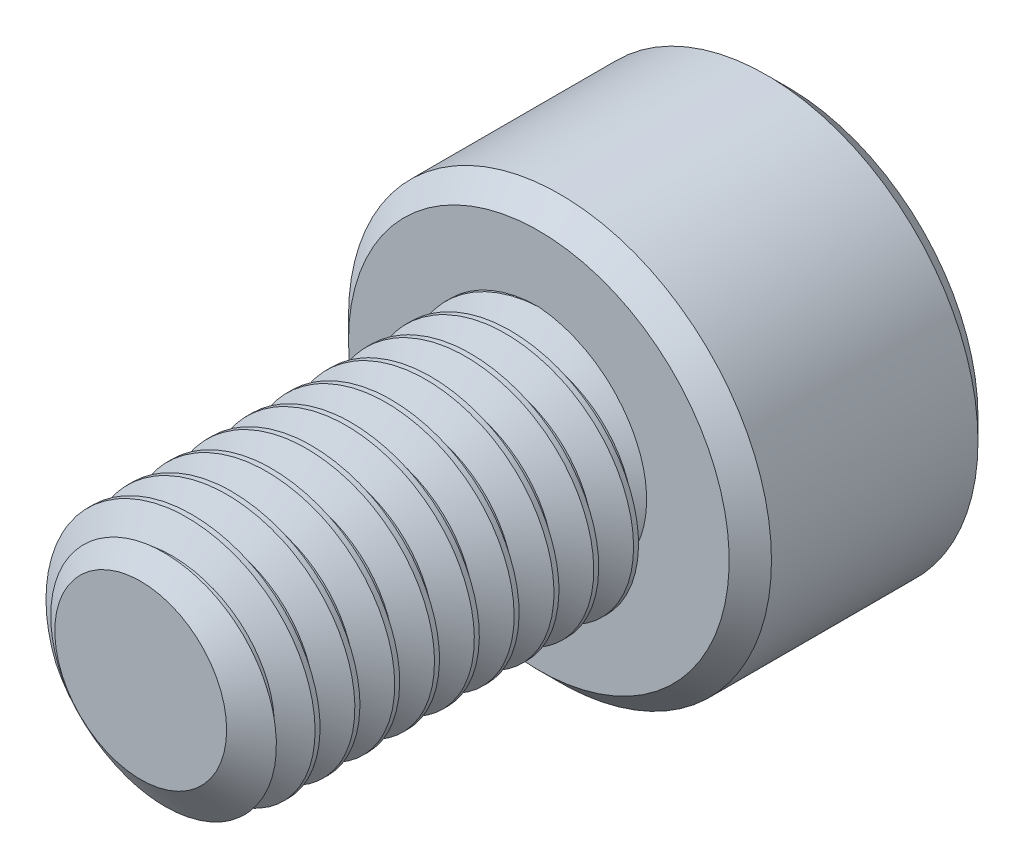
from build123d import *

# Parameters (mm, degrees)
SKETCH1_R          = 2.5
EXTRUDE1_DEPTH     = 8
CUT_SWEEP1_PITCH   = 0.8
SKETCH6_R          = 4.25
EXTRUDE2_DEPTH     = 5
CUT_EXTRUDE1_DEPTH = 3
CHAMFER1_SIZE      = 0.425


with BuildPart() as part:
    # Sketch1 → Extrude1 (new body)
    with BuildSketch(Plane.XY):
        Circle(SKETCH1_R)
    extrude(amount=-EXTRUDE1_DEPTH)

    # Cut-Sweep1: the profile of Sketch3 profile screwed along a right-hand helix of 11 turns, 6 arcs to a turn; built about Z, then put on its axis
    cut_sweep1_z = Axis((0, 0, 0), (0, 0, 1))
    cut_sweep1_corners = [(2.5003, 0, -0.700173205), (1.980384758, 0, -0.4), (1.980384758, 0, -0.3), (2.5003, 0, 0.000173205)]
    with BuildLine(mode=Mode.PRIVATE) as cut_sweep1_profile:
        Line(cut_sweep1_corners[0], cut_sweep1_corners[1])
        Line(cut_sweep1_corners[1], cut_sweep1_corners[2])
        Line(cut_sweep1_corners[2], cut_sweep1_corners[3])
        Line(cut_sweep1_corners[3], cut_sweep1_corners[0])
    cut_sweep1_cap = Face(cut_sweep1_profile.wire())
    cut_sweep1_turn_angles = [0, 30, 60, 90, 120, 150, 180, 210, 240, 270, 300, 330, 360]
    cut_sweep1_turn_weights = [1, 0.8660254037844387, 1, 0.8660254037844387, 1, 0.8660254037844387, 1, 0.8660254037844387, 1, 0.8660254037844387, 1, 0.8660254037844387, 1]
    cut_sweep1_turn_rails = [Edge.make_bspline([Vector(p[0], p[1], 0).rotate(cut_sweep1_z, cut_sweep1_turn_angles[k]) / cut_sweep1_turn_weights[k] + Vector(0, 0, p[2] + CUT_SWEEP1_PITCH * cut_sweep1_turn_angles[k] / 360) for k in range(13)], [0, 0, 0, 1, 1, 2, 2, 3, 3, 4, 4, 5, 5, 6, 6, 6], 2, cut_sweep1_turn_weights) for p in cut_sweep1_corners]
    cut_sweep1_turn_sides = [Face.make_surface_from_curves(cut_sweep1_turn_rails[p[0]], cut_sweep1_turn_rails[p[1]]) for p in [(0, 1), (1, 2), (2, 3), (3, 0)]]
    cut_sweep1 = Plane(origin=(0, 0, 0), x_dir=(0, 1, 0), z_dir=(0, 0, -1)) * Solid(Shell([*[p.moved(Location((0, 0, CUT_SWEEP1_PITCH * i))) for i in range(11) for p in cut_sweep1_turn_sides], cut_sweep1_cap, cut_sweep1_cap.rotate(cut_sweep1_z, 3960).moved(Location((0, 0, CUT_SWEEP1_PITCH * 3960 / 360)))]))
    add(cut_sweep1, mode=Mode.SUBTRACT)

    # Sketch4 → Cut-Revolve1 (revolve, cut)
    with BuildSketch(Plane(origin=(0, 0, 0), x_dir=(0, 0, -1), z_dir=(1, 0, 0)), mode=Mode.PRIVATE) as cut_revolve1_sk:
        Polygon((0.541691224, 2.5), (0, 1.726384758), (0, 2.5), align=None)
    revolve(cut_revolve1_sk.sketch.rotate(Axis((0, 0, 0), (0, 0, -1)), 260.43858876), axis=Axis((0, 0, 0), (0, 0, -1)), mode=Mode.SUBTRACT)

    # Sketch6 → Extrude2 (add)
    with BuildSketch(Plane(origin=(0, 0, -8), x_dir=(-1, 0, 0), z_dir=(0, 0, -1))):
        Circle(SKETCH6_R)
    extrude(amount=EXTRUDE2_DEPTH)

    # Sketch7 → Cut-Extrude1 (cut)
    with BuildSketch(Plane(origin=(0, 0, -13), x_dir=(-1, 0, 0), z_dir=(0, 0, -1))):
        Polygon((0, 2.309401077), (-2, 1.154700538), (-2, -1.154700538), (0, -2.309401077), (2, -1.154700538), (2, 1.154700538), align=None)
    extrude(amount=-CUT_EXTRUDE1_DEPTH, mode=Mode.SUBTRACT)

    # Cut-Extrude2 cone 1 section (through the dimple's axis) → Cut-Extrude2 (revolve, cut)
    with BuildSketch(Plane(origin=(0, 0, -13), x_dir=(0, 1, 0), z_dir=(1, 0, 0))):
        Polygon((0, 0), (2.309401077, 0), (0, 2.309401077), align=None)
    revolve(axis=Axis((0, 0, -13), (0, 0, 1)), mode=Mode.SUBTRACT)

    # Chamfer1
    chamfer1_edges = [part.edges().sort_by_distance(p)[0] for p in [
        (4.25, 0, -8),
        (4.25, 0, -13),
    ]]
    chamfer(chamfer1_edges, length=CHAMFER1_SIZE)


solid = part.part
